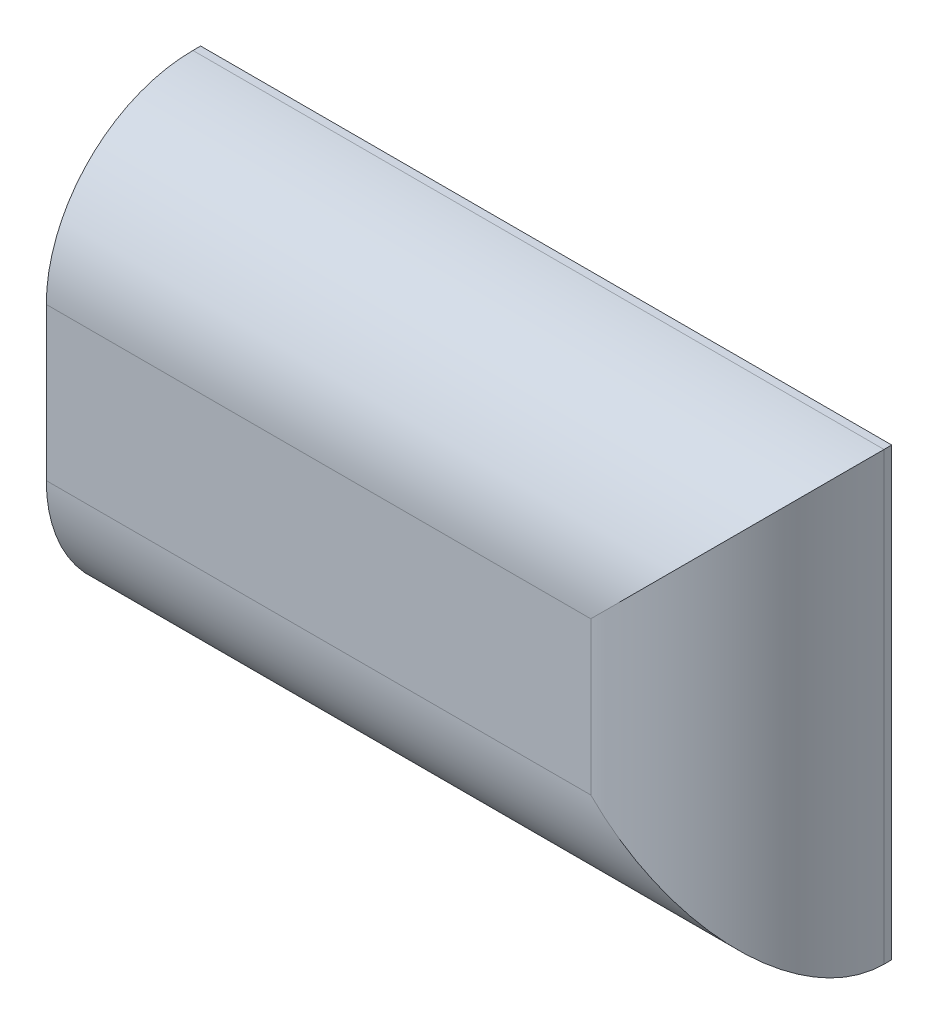
from build123d import *

# Parameters (mm, degrees)
SKETCH1_W           = 447.768130407
SKETCH1_H           = 288.852208244
BOSS_EXTRUDE1_DEPTH = 100
FILLET1_R           = 95


with BuildPart() as part:
    # Sketch1 → Boss-Extrude1 (new body)
    with BuildSketch(Plane.XY):
        with Locations((66.725597769, 382.240557344)):
            Rectangle(SKETCH1_W, SKETCH1_H)
    extrude(amount=BOSS_EXTRUDE1_DEPTH)

    # Fillet1
    fillet1_edges = [part.edges().sort_by_distance(p)[0] for p in [
        (66.725597768, 526.666661466, 100),
        (290.609662972, 382.240557344, 100),
        (66.725597768, 237.814453222, 100),
    ]]
    fillet(fillet1_edges, radius=FILLET1_R)


solid = part.part
